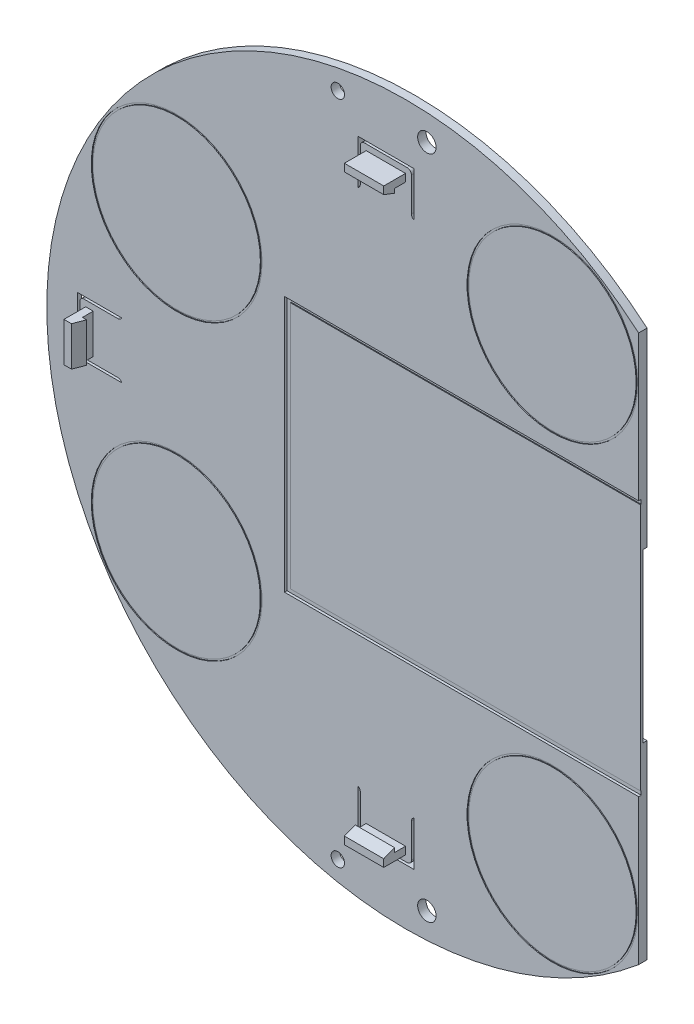
from build123d import *

# Parameters (mm, degrees)
SKETCH1_R           = 2.2
SKETCH1_R_2         = 1.6
BOSS_EXTRUDE1_DEPTH = 2
SKETCH3_R           = 20.4
SKETCH3_R_2         = 20
CUT_EXTRUDE9_DEPTH  = 0.2
SKETCH6_W           = 9.4
SKETCH6_H           = 1.8
BOSS_EXTRUDE2_DEPTH = 5.2
SKETCH7_W           = 1.8
SKETCH7_H           = 9.4
BOSS_EXTRUDE3_DEPTH = 5.2
BOSS_EXTRUDE4_DEPTH = 9.4
CUT_EXTRUDE10_DEPTH = 0.6
SKETCH11_W          = 83.6
SKETCH11_H          = 59.2
CUT_EXTRUDE11_DEPTH = 0.4
BOSS_EXTRUDE5_DEPTH = 9.4
CUT_EXTRUDE12_DEPTH = 1
CUT_EXTRUDE13_DEPTH = 10
FILLET1_R           = 1
FILLET4_R           = 1
FILLET8_R           = 1
FILLET9_R           = 1
FILLET10_R          = 1


with BuildPart() as part:
    # Sketch1 → Boss-Extrude1 (new body)
    with BuildSketch(Plane(origin=(0, 0, 0), x_dir=(0, 1, 0), z_dir=(0, 0, 1))):
        with BuildLine():
            Line((65.347379442, -55.6), (-65.347379442, -55.6))
            ThreePointArc((-65.347379442, -55.6), (0, 85.8), (65.347379442, -55.6))
        make_face()
        with Locations(Location((-79.5, -5, 0), (0, 0, 270))):
            Circle(SKETCH1_R, mode=Mode.SUBTRACT)
        with Locations(Location((-79.5, 16.27256024, 0), (0, 0, 270))):
            Circle(SKETCH1_R_2, mode=Mode.SUBTRACT)
        with Locations(Location((79.5, 16.27256024, 0), (0, 0, 90))):
            Circle(SKETCH1_R_2, mode=Mode.SUBTRACT)
        with Locations(Location((79.5, -5, 0), (0, 0, 90))):
            Circle(SKETCH1_R, mode=Mode.SUBTRACT)
    extrude(amount=BOSS_EXTRUDE1_DEPTH)

    # Sketch3 → Cut-Extrude9 (cut)
    # profile 1 of 4: a face of its own
    with BuildSketch(Plane.XY.offset(2)):
        with Locations((-54.772, 35.000400226)):
            Circle(SKETCH3_R)
        with Locations((-54.772, 35.000400226)):
            Circle(SKETCH3_R_2, mode=Mode.SUBTRACT)
    # profile 2 of 4: a face of its own
    with BuildSketch(Plane.XY.offset(2)):
        with Locations(Location((-54.772, -35.000400226, 0), (0, 0, 180))):
            Circle(SKETCH3_R)
        with Locations(Location((-54.772, -35.000400226, 0), (0, 0, 180))):
            Circle(SKETCH3_R_2, mode=Mode.SUBTRACT)
    # profile 3 of 4: a face of its own
    with BuildSketch(Plane.XY.offset(2)):
        with Locations((35, -54.772255751)):
            Circle(SKETCH3_R)
        with Locations((35, -54.772255751)):
            Circle(SKETCH3_R_2, mode=Mode.SUBTRACT)
    # profile 4 of 4: a face of its own
    with BuildSketch(Plane.XY.offset(2)):
        with Locations((35, 54.772255751)):
            Circle(SKETCH3_R)
        with Locations((35, 54.772255751)):
            Circle(SKETCH3_R_2, mode=Mode.SUBTRACT)
    extrude(amount=-CUT_EXTRUDE9_DEPTH, mode=Mode.SUBTRACT)

    # Sketch6 → Boss-Extrude2 (add)
    with BuildSketch(Plane.XY.offset(2)):
        with Locations((-4.8, -69.6)):
            Rectangle(SKETCH6_W, SKETCH6_H)
        with Locations((-4.8, 69.6)):
            Rectangle(SKETCH6_W, SKETCH6_H)
    extrude(amount=BOSS_EXTRUDE2_DEPTH)

    # Sketch7 → Boss-Extrude3 (add)
    with BuildSketch(Plane.XY.offset(2)):
        with Locations((-75.6, 0)):
            Rectangle(SKETCH7_W, SKETCH7_H)
    extrude(amount=BOSS_EXTRUDE3_DEPTH)

    # Sketch8 → Boss-Extrude4 (add)
    with BuildSketch(Plane.YZ.offset(-0.1)):
        Polygon((-68.7, 7.2), (-68.7, 4.6), (-67.7, 4.6), align=None)
        Polygon((67.7, 4.6), (68.7, 7.2), (68.7, 4.6), align=None)
    extrude(amount=-BOSS_EXTRUDE4_DEPTH)

    # Sketch10 → Cut-Extrude10 (cut)
    with BuildSketch(Plane.XY.offset(2)):
        Polygon((55.6, -29.6), (-28, -29.6), (-28, 29.6), (55.6, 29.6), (55.6, 30.6), (-29, 30.6), (-29, -30.6), (55.6, -30.6), align=None)
    extrude(amount=-CUT_EXTRUDE10_DEPTH, mode=Mode.SUBTRACT)

    # Sketch11 → Cut-Extrude11 (cut)
    with BuildSketch(Plane.XY.offset(2)):
        with Locations((13.8, 0)):
            Rectangle(SKETCH11_W, SKETCH11_H)
    extrude(amount=-CUT_EXTRUDE11_DEPTH, mode=Mode.SUBTRACT)

    # Sketch13 → Boss-Extrude5 (add)
    with BuildSketch(Plane.XZ.offset(4.7)):
        Polygon((-74.7, 7.2), (-74.7, 4.6), (-73.7, 4.6), align=None)
    extrude(amount=-BOSS_EXTRUDE5_DEPTH)

    # Sketch15 → Cut-Extrude12 (cut)
    with BuildSketch(Plane(origin=(0, 0, 0), x_dir=(1, 0, 0), z_dir=(0, 0, -1))):
        with BuildLine():
            Line((-83.436442877, 20), (55.6, 20))
            Line((55.6, 20), (55.6, -20))
            Line((55.6, -20), (-83.436442877, -20))
            ThreePointArc((-83.436442877, -20), (-85.8, 0), (-83.436442877, 20))
        make_face()
    extrude(amount=-CUT_EXTRUDE12_DEPTH, mode=Mode.SUBTRACT)

    # Sketch17 → Cut-Extrude13 (cut)
    with BuildSketch(Plane.XY.offset(2)):
        Polygon((-10.9, -71.9), (-10.9, -61.9), (-11.5, -61.9), (-11.5, -72.5), (1.9, -72.5), (1.9, -61.9), (1.3, -61.9), (1.3, -71.9), align=None)
        Polygon((1.9, 72.5), (-11.5, 72.5), (-11.5, 61.9), (-10.9, 61.9), (-10.9, 71.9), (1.3, 71.9), (1.3, 61.9), (1.9, 61.9), align=None)
        Polygon((-78.5, 6.7), (-78.5, -6.7), (-67.9, -6.7), (-67.9, -6.1), (-77.9, -6.1), (-77.9, 6.1), (-67.9, 6.1), (-67.9, 6.7), align=None)
    extrude(amount=-CUT_EXTRUDE13_DEPTH, mode=Mode.SUBTRACT)

    # Fillet1
    fillet1_edges = [part.edges().sort_by_distance(p)[0] for p in [
        (-10.9, -71.9, 1),
    ]]
    fillet(fillet1_edges, radius=FILLET1_R)

    # Fillet4
    # the kernel refuses this fillet: 1 mm, written as the material it adds along each edge
    with BuildSketch(Plane(origin=(1.3, -61.9, 2), x_dir=(0, -1, 0), z_dir=(0, 0, -1))) as fillet4_piece_1:
        with BuildLine():
            CenterArc((0.916515139, -1), FILLET4_R, 90, 66.421821522)
            Line((0, -0.6), (0, 0))
            Line((0, 0), (0.916515139, 0))
        make_face()
    extrude(amount=2)
    # the kernel refuses this fillet: 1 mm, written as the material it takes off along each edge
    with BuildSketch(Plane(origin=(1.3, -71.9, 4.5), x_dir=(-1, 0, 0), z_dir=(0, 0, -1))) as fillet4_2_piece_1:
        with BuildLine():
            CenterArc((FILLET4_R, FILLET4_R), FILLET4_R, 180, 90)
            Line((0, FILLET4_R), (0, 0))
            Line((0, 0), (FILLET4_R, 0))
        make_face()
    extrude(amount=7, mode=Mode.SUBTRACT)

    # Fillet8
    # the kernel refuses this fillet: 1 mm, written as the material it adds along each edge
    with BuildSketch(Plane(origin=(-10.9, -61.9, 2), x_dir=(0, -1, 0), z_dir=(0, 0, -1))) as fillet8_piece_1:
        with BuildLine():
            CenterArc((0.916515139, 1), FILLET8_R, 203.578178478, 66.421821522)
            Line((0, 0.6), (-0.018330303, 0.592))
            ThreePointArc((-0.018330303, 0.592), (-0.02, 0.3), (-0.02, 0))
            Line((-0.02, 0), (0, -0.02))
            Line((0, -0.02), (0.916515139, -0.02))
            Line((0.916515139, -0.02), (0.916515139, 0))
        make_face()
    extrude(amount=2)

    # Fillet9
    # the kernel refuses this fillet: 1 mm, written as the material it adds along each edge
    with BuildSketch(Plane(origin=(-10.9, 61.9, 2), x_dir=(-1, 0, 0), z_dir=(0, 0, -1))) as fillet9_piece_1:
        with BuildLine():
            CenterArc((1, 0.916515139), FILLET9_R, 180, 66.421821522)
            Line((0, 0.916515139), (0, 0))
            Line((0, 0), (0.6, 0))
        make_face()
    extrude(amount=2)
    with BuildSketch(Plane(origin=(1.3, 61.9, 2), x_dir=(1, 0, 0), z_dir=(0, 0, -1))) as fillet9_piece_2:
        with BuildLine():
            CenterArc((1, -0.916515139), FILLET9_R, 113.578178478, 66.421821522)
            Line((0, -0.916515139), (0, 0))
            Line((0, 0), (0.6, 0))
        make_face()
    extrude(amount=2)
    # the kernel refuses this fillet: 1 mm, written as the material it takes off along each edge
    with BuildSketch(Plane(origin=(1.3, 71.9, 4.5), x_dir=(0, -1, 0), z_dir=(0, 0, -1)), Plane(origin=(-10.9, 71.9, 4.5), x_dir=(1, 0, 0), z_dir=(0, 0, -1))) as fillet9_2_piece_1:
        with BuildLine():
            CenterArc((FILLET9_R, FILLET9_R), FILLET9_R, 180, 90)
            Line((0, FILLET9_R), (0, 0))
            Line((0, 0), (FILLET9_R, 0))
        make_face()
    extrude(amount=7, mode=Mode.SUBTRACT)

    # Fillet10
    # the kernel refuses this fillet: 1 mm, written as the material it adds along each edge
    with BuildSketch(Plane(origin=(-67.9, -6.1, 2), x_dir=(0, -1, 0), z_dir=(0, 0, -1))) as fillet10_piece_1:
        with BuildLine():
            CenterArc((1, 0.916515139), FILLET10_R, 180, 66.421821522)
            Line((0, 0.916515139), (0, 0))
            Line((0, 0), (0.6, 0))
        make_face()
    extrude(amount=1)
    with BuildSketch(Plane(origin=(-67.9, 6.1, 2), x_dir=(0, 1, 0), z_dir=(0, 0, -1))) as fillet10_piece_2:
        with BuildLine():
            CenterArc((1, -0.916515139), FILLET10_R, 113.578178478, 66.421821522)
            Line((0, -0.916515139), (0, 0))
            Line((0, 0), (0.6, 0))
        make_face()
    extrude(amount=1)
    # the kernel refuses this fillet: 1 mm, written as the material it takes off along each edge
    with BuildSketch(Plane(origin=(-77.9, -6.1, 4.5), x_dir=(1, 0, 0), z_dir=(0, 0, -1))) as fillet10_2_piece_1:
        with BuildLine():
            CenterArc((FILLET10_R, -FILLET10_R), FILLET10_R, 90, 90)
            Line((0, -FILLET10_R), (0, 0))
            Line((0, 0), (FILLET10_R, 0))
        make_face()
    extrude(amount=6, mode=Mode.SUBTRACT)
    with BuildSketch(Plane(origin=(-77.9, 6.1, 4.5), x_dir=(1, 0, 0), z_dir=(0, 0, -1))) as fillet10_2_piece_2:
        with BuildLine():
            CenterArc((FILLET10_R, FILLET10_R), FILLET10_R, 180, 90)
            Line((0, FILLET10_R), (0, 0))
            Line((0, 0), (FILLET10_R, 0))
        make_face()
    extrude(amount=6, mode=Mode.SUBTRACT)


solid = part.part
